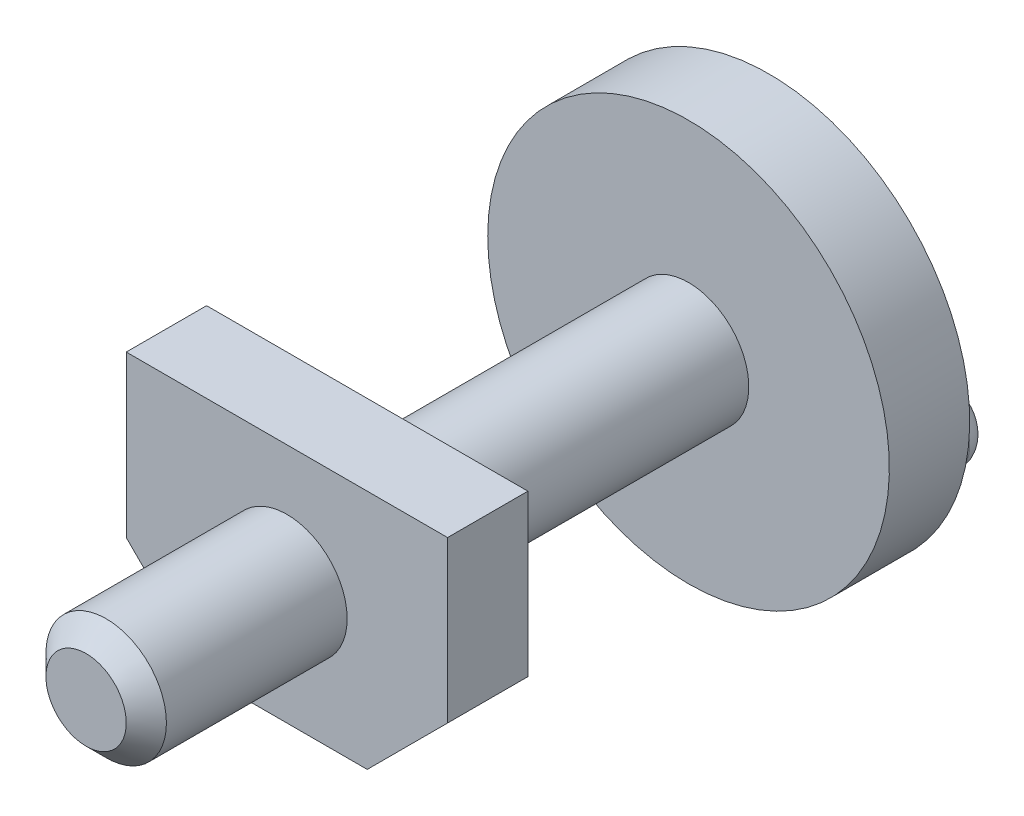
from build123d import *

# Parameters (mm, degrees)
SKETCH_1_R          = 15
EXTRUDE_1_DEPTH     = 150
SKETCH_2_R          = 50
EXTRUDE_2_DEPTH     = 20
SKETCH_3_R          = 42.5
SKETCH_3_R_2        = 25
CUT_EXTRUDE_1_DEPTH = 5
CHAMFER_1_SIZE      = 5
SKETCH_4_R          = 3.75
EXTRUDE_3_DEPTH     = 10
SKETCH_5_R          = 9
EXTRUDE_4_DEPTH     = 36
FILLET_2_R          = 5
CHAMFER_2_SIZE      = 5
CHAMFER_3_SIZE      = 5
SKETCH_6_W          = 80
SKETCH_6_H          = 60
EXTRUDE_5_DEPTH     = 20
CHAMFER_4_SIZE      = 20


with BuildPart() as part:
    # 草图1 → 凸台-拉伸1 (new body)
    with BuildSketch(Plane.XY):
        Circle(SKETCH_1_R)
    extrude(amount=EXTRUDE_1_DEPTH)

    # 草图2 → 凸台-拉伸2 (add)
    with BuildSketch(Plane(origin=(0, 0, 0), x_dir=(-1, 0, 0), z_dir=(0, 0, -1))):
        Circle(SKETCH_2_R)
    extrude(amount=EXTRUDE_2_DEPTH)

    # 草图3 → 切除-拉伸1 (cut)
    with BuildSketch(Plane(origin=(0, 0, -20), x_dir=(-1, 0, 0), z_dir=(0, 0, -1))):
        Circle(SKETCH_3_R)
        Circle(SKETCH_3_R_2, mode=Mode.SUBTRACT)
    extrude(amount=-CUT_EXTRUDE_1_DEPTH, mode=Mode.SUBTRACT)

    # 倒角1
    chamfer_1_edges = [part.edges().sort_by_distance(p)[0] for p in [
        (42.5, 0, -15),
        (25, 0, -15),
    ]]
    chamfer(chamfer_1_edges, length=CHAMFER_1_SIZE - 0.0001)  # a hair under: the kernel refuses the full size

    # 草图4 → 凸台-拉伸3 (add)
    with BuildSketch(Plane(origin=(0, 0, -20), x_dir=(-1, 0, 0), z_dir=(0, 0, -1))):
        with Locations(Location((0, -46.25, 0), (0, 0, 269.999564815))):
            Circle(SKETCH_4_R)
    extrude(amount=EXTRUDE_3_DEPTH)

    # 草图5 → 凸台-拉伸4 (add)
    with BuildSketch(Plane(origin=(0, 0, -30), x_dir=(-1, 0, 0), z_dir=(0, 0, -1))):
        with Locations((0, -46.25)):
            Circle(SKETCH_5_R)
    extrude(amount=EXTRUDE_4_DEPTH)

    # 圆角2
    fillet_2_edges = [part.edges().sort_by_distance(p)[0] for p in [
        (9, -46.25, -66),
    ]]
    fillet(fillet_2_edges, radius=FILLET_2_R)

    # 倒角2
    chamfer_2_edges = [part.edges().sort_by_distance(p)[0] for p in [
        (-2.8483e-05, -42.5, -30),
    ]]
    chamfer(chamfer_2_edges, length=CHAMFER_2_SIZE)

    # 倒角3
    chamfer_3_edges = [part.edges().sort_by_distance(p)[0] for p in [
        (-15, 0, 150),
    ]]
    chamfer(chamfer_3_edges, length=CHAMFER_3_SIZE)

    # 草图6 → 凸台-拉伸5 (add)
    with BuildSketch(Plane.XY.offset(80)):
        Rectangle(SKETCH_6_W, SKETCH_6_H)
    extrude(amount=EXTRUDE_5_DEPTH)

    # 倒角4
    chamfer_4_edges = [part.edges().sort_by_distance(p)[0] for p in [
        (40, -30, 90),
        (-40, -30, 90),
    ]]
    chamfer(chamfer_4_edges, length=CHAMFER_4_SIZE)


solid = part.part
